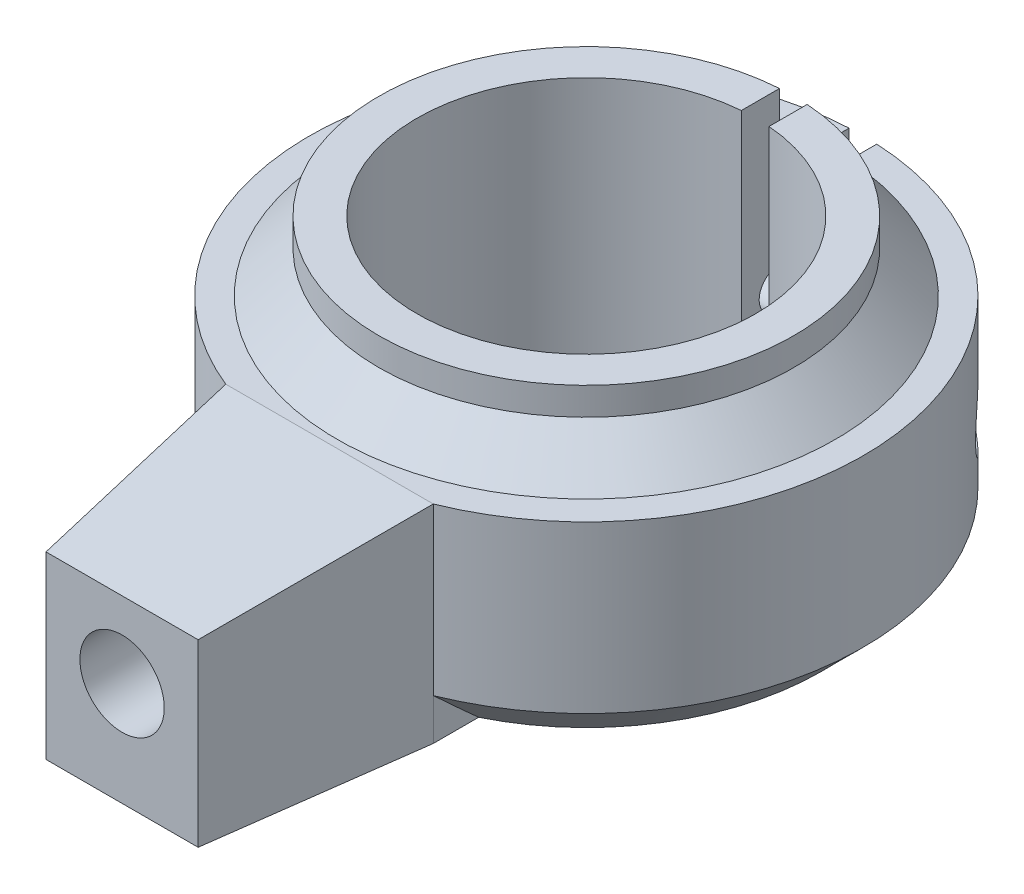
from build123d import *
from OCP.BRepFilletAPI import BRepFilletAPI_MakeChamfer

# Parameters (mm, degrees)
BOSS_EXTRUDE1_DEPTH     = 15
SKETCH2_R               = 3.05
CUT_EXTRUDE1_DEPTH      = 15
BOSS_EXTRUDE2_DEPTH     = 5
CHAMFER4_SIZE           = 3
CHAMFER6_SIZE           = 15
CHAMFER6_SIZE_2         = 2
CUT_EXTRUDE2_DEPTH      = 29
CUT_EXTRUDE2_DEPTH_BACK = 25
SKETCH4_R               = 1.5
SKETCH5_R               = 2.5
CUT_EXTRUDE3_DEPTH      = 14.024984395
CUT_EXTRUDE4_START      = -14.024984395
SKETCH6_R               = 2.5
CUT_EXTRUDE4_DEPTH      = 14.024984395


with BuildPart() as part:
    # Sketch1 → Boss-Extrude1 (new body)
    with BuildSketch(Plane(origin=(0, 0, 0), x_dir=(1, 0, 0), z_dir=(0, 1, 0))):
        with BuildLine():
            ThreePointArc((-14.719179189, 14.619614321), (-15.719179189, -9.839501126), (-16.719179189, 14.619614321))
            Line((-16.719179189, 14.619614321), (-16.719179189, 22.410498874))
            ThreePointArc((-16.719179189, 22.410498874), (-35.465683849, 5.738494325), (-23.219179189, -16.156945753))
            Line((-23.219179189, -16.156945753), (-23.219179189, -31.156945753))
            Line((-23.219179189, -31.156945753), (-8.219179189, -31.156945753))
            Line((-8.219179189, -31.156945753), (-8.219179189, -16.156945753))
            ThreePointArc((-8.219179189, -16.156945753), (4.02732547, 5.738494325), (-14.719179189, 22.410498874))
            Line((-14.719179189, 22.410498874), (-14.719179189, 14.619614321))
        make_face()
    extrude(amount=BOSS_EXTRUDE1_DEPTH)

    # Sketch2 → Cut-Extrude1 (cut)
    with BuildSketch(Plane.XY.offset(31.156945753)):
        with Locations((-15.719179189, 7.5)):
            Circle(SKETCH2_R)
    extrude(amount=-CUT_EXTRUDE1_DEPTH, mode=Mode.SUBTRACT)

    # Sketch3 → Boss-Extrude2 (add)
    with BuildSketch(Plane(origin=(0, 15, 0), x_dir=(1, 0, 0), z_dir=(0, 1, 0))):
        with BuildLine():
            Line((-16.719179189, 14.619614321), (-16.719179189, 17.377128421))
            ThreePointArc((-16.719179189, 17.377128421), (-25.966129955, -8.543952276), (-0.719179189, 2.410498874))
            ThreePointArc((-0.719179189, 2.410498874), (-4.764728039, 12.65744964), (-14.719179189, 17.377128421))
            Line((-14.719179189, 17.377128421), (-14.719179189, 14.619614321))
            ThreePointArc((-14.719179189, 14.619614321), (-6.710502816, 10.711477732), (-3.469179189, 2.410498874))
            ThreePointArc((-3.469179189, 2.410498874), (-24.020158047, -6.598177499), (-16.719179189, 14.619614321))
        make_face()
    extrude(amount=BOSS_EXTRUDE2_DEPTH)

    # Chamfer4
    chamfer4_edges = [part.edges().sort_by_distance(p)[0] for p in [
        (-25.966129955, 15, 8.543952276),
        (-35.465683849, 0, -5.738494325),
        (4.02732547, 0, -5.738494325),
    ]]
    chamfer(chamfer4_edges, length=CHAMFER4_SIZE)

    # Chamfer6
    chamfer6_edges_1 = [part.edges().sort_by_distance(p)[0] for p in [
        (-23.219179189, 7.5, 31.156945753),
    ]]
    chamfer6_side_1 = [part.faces().sort_by_distance(p)[0] for p in [
        (-23.219179189, 7.5, 31.116945753),
    ]]
    chamfer6_edges_2 = [part.edges().sort_by_distance(p)[0] for p in [
        (-8.219179189, 7.5, 31.156945753),
    ]]
    chamfer6_side_2 = [part.faces().sort_by_distance(p)[0] for p in [
        (-8.259179189, 7.5, 31.156945753),
    ]]
    chamfer6_edges_3 = [part.edges().sort_by_distance(p)[0] for p in [
        (-15.719179189, 15, 31.156945753),
    ]]
    chamfer6_side_3 = [part.faces().sort_by_distance(p)[0] for p in [
        (-15.719179189, 14.96, 31.156945753),
    ]]
    chamfer6 = BRepFilletAPI_MakeChamfer(part.part.solid().wrapped)
    for e in chamfer6_edges_1:
        chamfer6.Add(CHAMFER6_SIZE - 0.0001, CHAMFER6_SIZE_2 - 0.0001, e.wrapped, chamfer6_side_1[0].wrapped)
    for e in chamfer6_edges_2:
        chamfer6.Add(CHAMFER6_SIZE_2 - 0.0001, CHAMFER6_SIZE - 0.0001, e.wrapped, chamfer6_side_2[0].wrapped)
    for e in chamfer6_edges_3:
        chamfer6.Add(CHAMFER6_SIZE_2 - 0.0001, CHAMFER6_SIZE - 0.0001, e.wrapped, chamfer6_side_3[0].wrapped)
    add(Compound.cast(chamfer6.Shape()), mode=Mode.REPLACE)  # a hair under: the kernel refuses the full size

    # Sketch4 → Cut-Extrude2 (cut, two sides: drawn at the far end of the back side and taken through both)
    with BuildSketch(Plane.ZY.offset(14.719179189).offset(-CUT_EXTRUDE2_DEPTH_BACK)):
        with Locations(Location((-17.410498874, 7.5, 0), (0, 0, 180))):
            Circle(SKETCH4_R)
    extrude(amount=CUT_EXTRUDE2_DEPTH + CUT_EXTRUDE2_DEPTH_BACK, mode=Mode.SUBTRACT)

    # Sketch5 → Cut-Extrude3 (cut)
    with BuildSketch(Plane(origin=(4.305805205, 0, 0), x_dir=(0, 0, -1), z_dir=(1, 0, 0))):
        with Locations((17.410498874, 7.5)):
            Circle(SKETCH5_R)
    extrude(amount=-CUT_EXTRUDE3_DEPTH, mode=Mode.SUBTRACT)

    # Sketch6 → Cut-Extrude4 (cut)
    with BuildSketch(Plane.ZY.offset(35.744163584).offset(CUT_EXTRUDE4_START)):
        with Locations(Location((-17.410498874, 7.5, 0), (0, 0, 180))):
            Circle(SKETCH6_R)
    extrude(amount=CUT_EXTRUDE4_DEPTH, mode=Mode.SUBTRACT)


solid = part.part
